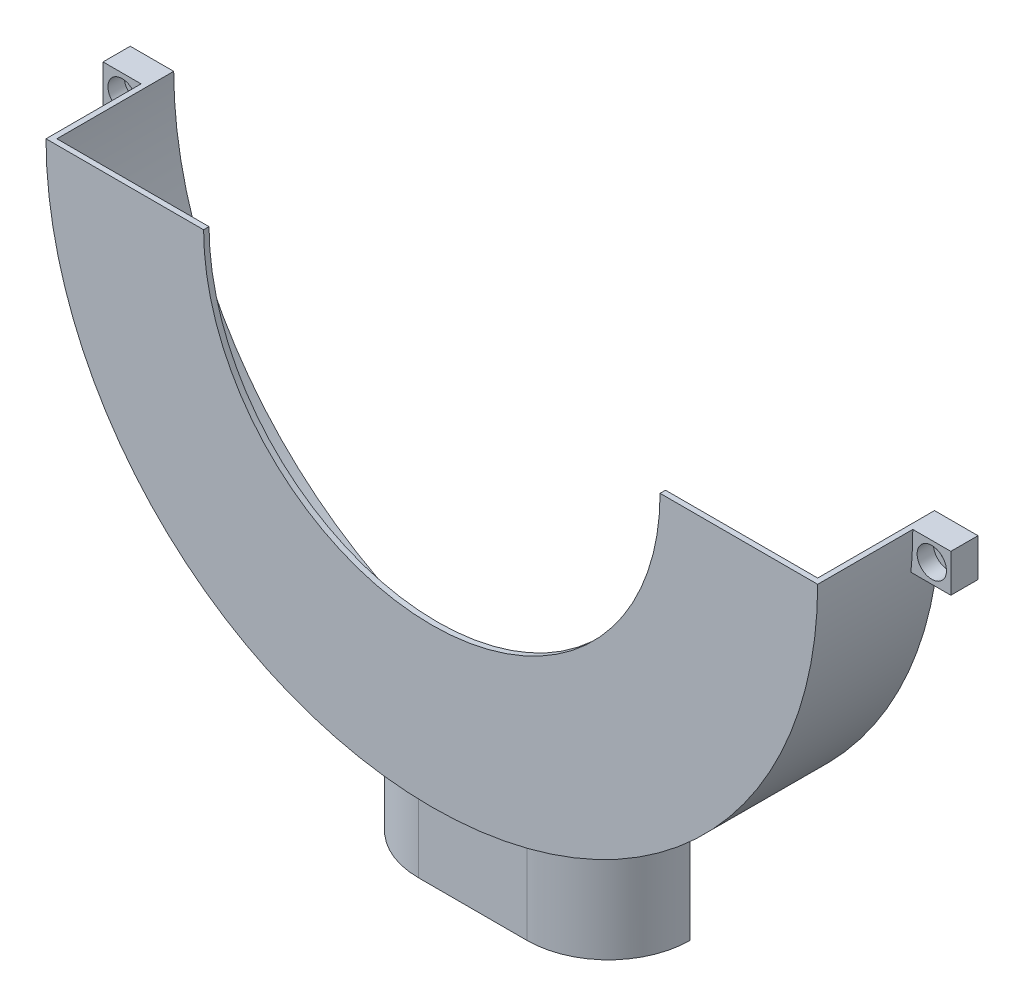
from build123d import *

# Parameters (mm, degrees)
BOSS_EXTRUDE1_DEPTH = 21.5
BOSS_EXTRUDE2_DEPTH = 1
SKETCH3_W           = 50
SKETCH3_H           = 20
BOSS_EXTRUDE3_DEPTH = 15
SKETCH8_R           = 1.6
BOSS_EXTRUDE5_DEPTH = 5
SKETCH10_R          = 2.7
SKETCH10_R_2        = 2.6
CUT_EXTRUDE5_DEPTH  = 3
FILLET2_R           = 15
SKETCH11_W          = 43.237900078
SKETCH11_H          = 3
CUT_EXTRUDE7_DEPTH  = 20


with BuildPart() as part:
    # Sketch1 → Boss-Extrude1 (new body)
    with BuildSketch(Plane.XY):
        with BuildLine():
            Line((71, 0), (70, 0))
            ThreePointArc((70, 0), (0, -70), (-70, 0))
            Line((-70, 0), (-71, 0))
            ThreePointArc((-71, 0), (0, -71), (71, 0))
        make_face()
    extrude(amount=BOSS_EXTRUDE1_DEPTH)

    # Sketch2 → Boss-Extrude2 (add)
    with BuildSketch(Plane.XY.offset(21.5)):
        with BuildLine():
            Line((71, 0), (70, 0))
            ThreePointArc((70, 0), (0, -70), (-70, 0))
            Line((-70, 0), (-71, 0))
            ThreePointArc((-71, 0), (0, -71), (71, 0))
        make_face()
        with BuildLine():
            Line((-42, 0), (-70, 0))
            ThreePointArc((-70, 0), (0, -70), (70, 0))
            Line((70, 0), (42, 0))
            ThreePointArc((42, 0), (0, -42), (-42, 0))
        make_face()
    extrude(amount=BOSS_EXTRUDE2_DEPTH)

    # Sketch3 → Boss-Extrude3 (add)
    with BuildSketch(Plane(origin=(0, 0, 0), x_dir=(-1, 0, 0), z_dir=(0, 0, -1))):
        with BuildLine():
            Line((-25, -66.452990903), (-25, -71))
            Line((-25, -71), (0, -71))
            ThreePointArc((0, -71), (-12.705070757, -69.853999006), (-25, -66.452990903))
        make_face()
        with BuildLine():
            ThreePointArc((25, -66.452990903), (12.705070757, -69.853999006), (0, -71))
            Line((0, -71), (25, -71))
            Line((25, -71), (25, -66.452990903))
        make_face()
        with Locations((0, -81)):
            Rectangle(SKETCH3_W, SKETCH3_H)
    extrude(amount=-BOSS_EXTRUDE3_DEPTH)

    # Sketch8 → Boss-Extrude5 (add)
    # profile 1 of 2: a face of its own
    with BuildSketch(Plane(origin=(0, 0, 0), x_dir=(-1, 0, 0), z_dir=(0, 0, -1))):
        with BuildLine():
            ThreePointArc((-70.654086931, -7), (-70.913469003, -3.504270818), (-71, 0))
            Line((-71, 0), (-78, 0))
            Line((-78, 0), (-78, -7))
            Line((-78, -7), (-70.654086931, -7))
        make_face()
        with Locations((-74.5, -3.5)):
            Circle(SKETCH8_R, mode=Mode.SUBTRACT)
    # profile 2 of 2: a face of its own
    with BuildSketch(Plane(origin=(0, 0, 0), x_dir=(-1, 0, 0), z_dir=(0, 0, -1))):
        with BuildLine():
            Line((78, 0), (71, 0))
            ThreePointArc((71, 0), (70.913469003, -3.504270818), (70.654086931, -7))
            Line((70.654086931, -7), (78, -7))
            Line((78, -7), (78, 0))
        make_face()
        with Locations(Location((74.5, -3.5, 0), (0, 0, 180))):
            Circle(SKETCH8_R, mode=Mode.SUBTRACT)
    extrude(amount=-BOSS_EXTRUDE5_DEPTH)

    # Sketch10 → Cut-Extrude5 (cut)
    with BuildSketch(Plane.XY.offset(5)):
        with Locations((74.5, -3.5)):
            Circle(SKETCH10_R)
        with Locations((-74.5, -3.5)):
            Circle(SKETCH10_R_2)
    extrude(amount=-CUT_EXTRUDE5_DEPTH, mode=Mode.SUBTRACT)

    # Fillet2
    fillet2_edges = [part.edges().sort_by_distance(p)[0] for p in [
        (-25, -78.726495452, 15),
        (25, -78.726495452, 15),
    ]]
    fillet(fillet2_edges, radius=FILLET2_R - 0.0001)  # a hair under: the kernel refuses the full size

    # Sketch11 → Cut-Extrude7 (cut)
    with BuildSketch(Plane.XZ.offset(91)):
        with Locations((0, 1.5)):
            Rectangle(SKETCH11_W, SKETCH11_H)
        with BuildLine():
            Line((-21.618950039, 3), (21.618950039, 3))
            ThreePointArc((21.618950039, 3), (17.348469228, 9.486832981), (10, 12))
            Line((10, 12), (-10, 12))
            ThreePointArc((-10, 12), (-17.348469228, 9.486832981), (-21.618950039, 3))
        make_face()
    extrude(amount=-CUT_EXTRUDE7_DEPTH, mode=Mode.SUBTRACT)


solid = part.part
